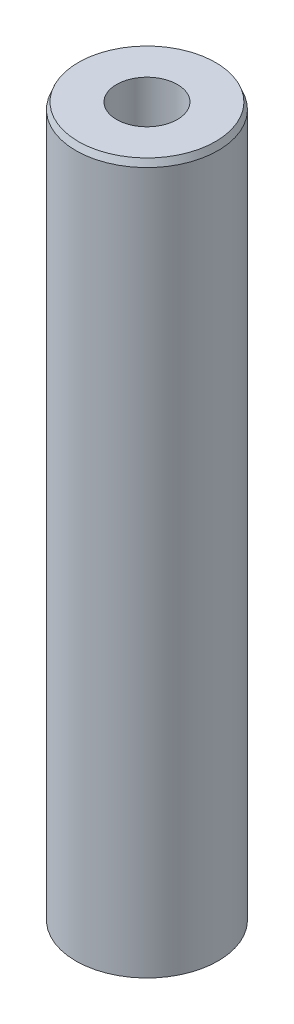
from build123d import *
from OCP.BRepFilletAPI import BRepFilletAPI_MakeChamfer

# Parameters (mm, degrees)
SKETCH1_R           = 60
BOSS_EXTRUDE1_DEPTH = 600
SKETCH2_R           = 25.667759428
CUT_EXTRUDE1_DEPTH  = 606.970296302
CHAMFER1_SIZE       = 5.540842901
CHAMFER1_SIZE2      = 2.12822243


with BuildPart() as part:
    # Sketch1 → Boss-Extrude1 (new body)
    with BuildSketch(Plane(origin=(0, 0, 0), x_dir=(1, 0, 0), z_dir=(0, 1, 0))):
        Circle(SKETCH1_R)
    extrude(amount=BOSS_EXTRUDE1_DEPTH)

    # Sketch2 → Cut-Extrude1 (cut, through all)
    with BuildSketch(Plane(origin=(0, 0, 0), x_dir=(1, 0, 0), z_dir=(0, 1, 0))):
        Circle(SKETCH2_R)
    extrude(amount=CUT_EXTRUDE1_DEPTH, mode=Mode.SUBTRACT)

    # Chamfer1: one chamfer whose edges measure the first distance from different faces: ONE call of the kernel's chamfer builder (chamfer() names one face for all edges)
    chamfer1_edges_1 = [part.edges().sort_by_distance(p)[0] for p in [
        (-60, 600, 0),
    ]]
    chamfer1_side_1 = [part.faces().sort_by_distance(p)[0] for p in [
        (-60, 300, 0),
    ]]
    chamfer1_edges_2 = [part.edges().sort_by_distance(p)[0] for p in [
        (-60, 0, 0),
    ]]
    chamfer1_side_2 = [part.faces().sort_by_distance(p)[0] for p in [
        (-58.302943725, 0, 0),
    ]]
    chamfer1 = BRepFilletAPI_MakeChamfer(part.part.solid().wrapped)
    for e in chamfer1_edges_1:
        chamfer1.Add(CHAMFER1_SIZE, CHAMFER1_SIZE2, e.wrapped, chamfer1_side_1[0].wrapped)  # the first distance lies on this face
    for e in chamfer1_edges_2:
        chamfer1.Add(CHAMFER1_SIZE, CHAMFER1_SIZE2, e.wrapped, chamfer1_side_2[0].wrapped)  # the first distance lies on this face
    add(Compound.cast(chamfer1.Shape()), mode=Mode.REPLACE)


solid = part.part
